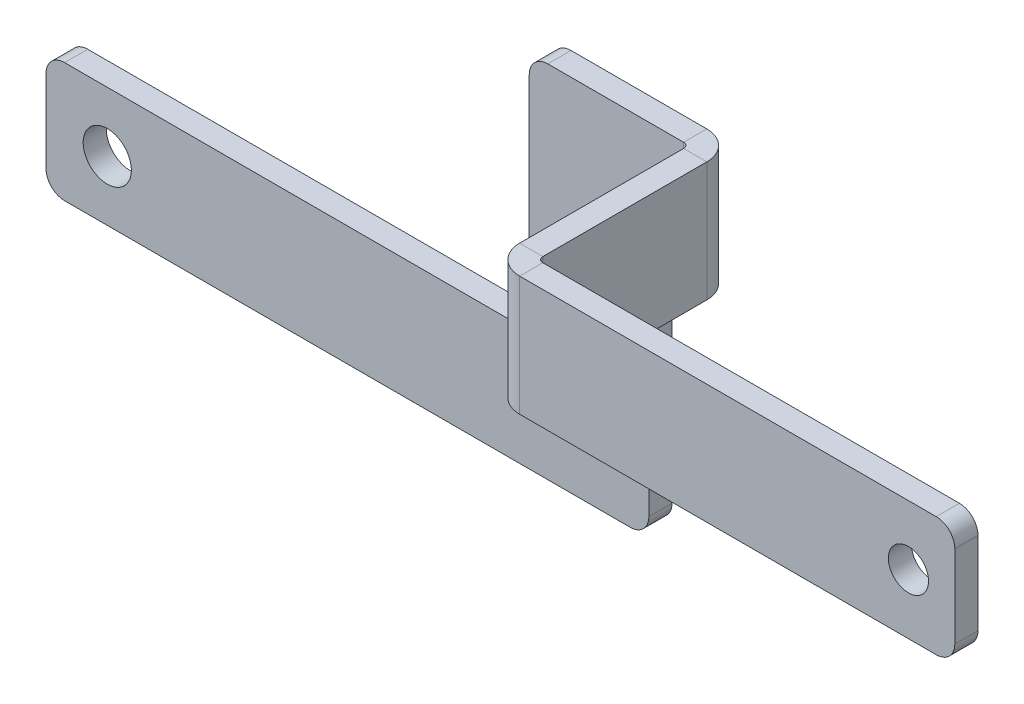
from build123d import *

# Parameters (mm, degrees)
BASE_FLANGE1_DEPTH           = 3.175
EDGE_FLANGE1_DEPTH           = 16.378
EDGE_FLANGE2_STRIP_W         = 14.1732
EDGE_FLANGE2_STRIP_H         = 3.175
EDGE_FLANGE2_STRIP_CUT_DEPTH = 16.378
EDGE_FLANGE2_DEPTH           = 16.378
M5_CLEARANCE_HOLE1_D         = 5.5
M6_CLEARANCE_HOLE1_D         = 6.6
FILLET1_R                    = 2.54


# Sheet-metal steps are written as plain solids
with BuildPart() as part:
    # Sketch1 → Base-Flange1 (new body)
    with BuildSketch(Plane.XY):
        Polygon((40.772, -29.184600001), (40.772, -45.562600001), (40.772, -62.123600001), (-25.39999999, -62.123600001), (-25.39999999, -78.501600001), (57.15000001, -78.501600001), (57.15000001, -45.562600001), (61.9125, -45.562600001), (61.9125, -29.184600001), align=None)
    extrude(amount=-BASE_FLANGE1_DEPTH)

    # Edge-Flange1 section (across the edge) → Edge-Flange1 (add)
    with BuildSketch(Plane(origin=(62.6491, -45.562600001, 0), x_dir=(-1, 0, 0), z_dir=(0, 1, 0))):
        with BuildLine():
            Line((-3.175, 0.7366), (-3.175, 23.9268))
            Line((-3.175, 23.9268), (0, 23.9268))
            Line((0, 23.9268), (0, 0.7366))
            ThreePointArc((0, 0.7366), (0.215745145, 0.215745145), (0.7366, 0))
            Line((0.7366, 0), (0.7366, -3.175))
            ThreePointArc((0.7366, -3.175), (-2.029318885, -2.029318885), (-3.175, 0.7366))
        make_face()
    extrude(amount=EDGE_FLANGE1_DEPTH)

    # Edge-Flange2 strip (across the edge) → Edge-Flange2 strip cut (cut)
    with BuildSketch(Plane(origin=(65.8241, -29.184600001, 23.9268), x_dir=(0, 0, -1), z_dir=(0, -1, 0))):
        with Locations((-6.35, -1.5875)):
            Rectangle(EDGE_FLANGE2_STRIP_W, EDGE_FLANGE2_STRIP_H)
    extrude(amount=EDGE_FLANGE2_STRIP_CUT_DEPTH, mode=Mode.SUBTRACT)

    # Edge-Flange2 section (across the edge) → Edge-Flange2 (add)
    with BuildSketch(Plane(origin=(65.8241, -29.184600001, 23.9268), x_dir=(0, 0, -1), z_dir=(0, -1, 0))):
        with BuildLine():
            Line((-3.175, 0.7366), (-3.175, 60.325))
            Line((-3.175, 60.325), (0, 60.325))
            Line((0, 60.325), (0, 0.7366))
            ThreePointArc((0, 0.7366), (0.215745145, 0.215745145), (0.7366, 0))
            Line((0.7366, 0), (0.7366, -3.175))
            ThreePointArc((0.7366, -3.175), (-2.029318885, -2.029318885), (-3.175, 0.7366))
        make_face()
    extrude(amount=EDGE_FLANGE2_DEPTH)

    # M5 Clearance Hole1 (through all)
    with Locations(Plane.XY.offset(27.1018)):
        with Locations((119.7991, -37.373600001)):
            Hole(M5_CLEARANCE_HOLE1_D / 2)

    # M6 Clearance Hole1 (through all)
    with Locations(Plane.XY):
        with Locations((-17.0119, -70.312600001)):
            Hole(M6_CLEARANCE_HOLE1_D / 2)

    # Fillet1
    fillet1_edges = [part.edges().sort_by_distance(p)[0] for p in [
        (-25.39999999, -62.123600001, -1.5875),
        (40.772, -62.123600001, -1.5875),
        (40.772, -29.184600001, -1.5875),
        (57.15000001, -45.562600001, -1.5875),
        (57.15000001, -78.501600001, -1.5875),
        (-25.39999999, -78.501600001, -1.5875),
        (126.1491, -29.184600001, 25.5143),
        (126.1491, -45.562600001, 25.5143),
    ]]
    fillet(fillet1_edges, radius=FILLET1_R)


solid = part.part
